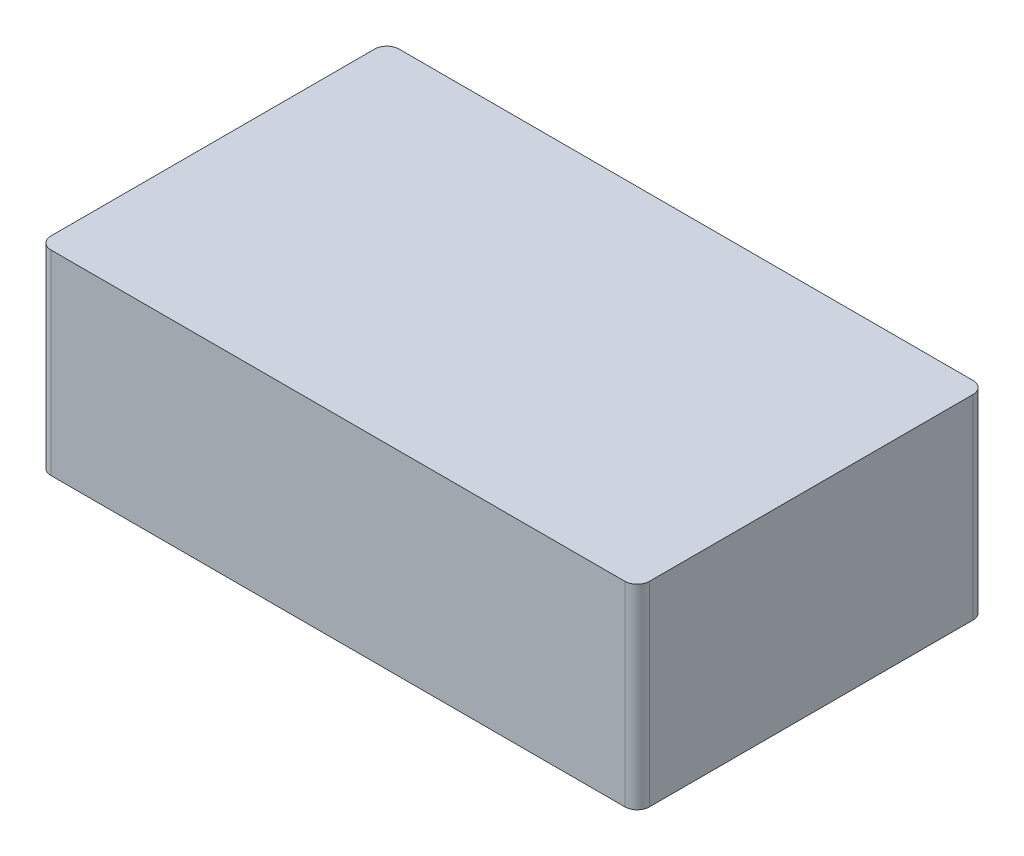
from build123d import *

# Parameters (mm, degrees)
SKETCH1_W           = 49
SKETCH1_H           = 28.5
BOSS_EXTRUDE1_DEPTH = 16
FILLET1_R           = 1


with BuildPart() as part:
    # Sketch1 → Boss-Extrude1 (new body)
    with BuildSketch(Plane(origin=(0, 0, 0), x_dir=(1, 0, 0), z_dir=(0, 1, 0))):
        Rectangle(SKETCH1_W, SKETCH1_H)
    extrude(amount=BOSS_EXTRUDE1_DEPTH)

    # Fillet1
    fillet1_edges = [part.edges().sort_by_distance(p)[0] for p in [
        (-24.5, 8, -14.25),
        (24.5, 8, -14.25),
        (24.5, 8, 14.25),
        (-24.5, 8, 14.25),
    ]]
    fillet(fillet1_edges, radius=FILLET1_R)


solid = part.part
